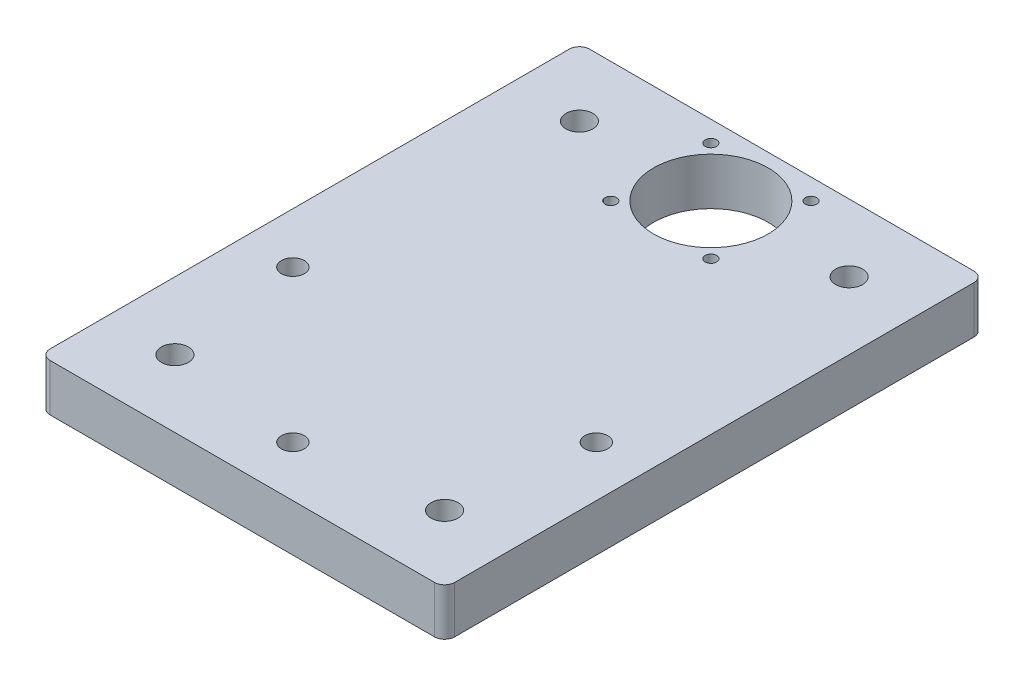
from build123d import *

# Parameters (mm, degrees)
EXTRUDE_1_DEPTH     = 14
SKETCH_3_R          = 1.7
CUT_EXTRUDE_1_DEPTH = 118.45637488
SKETCH_4_R          = 3.4
CUT_EXTRUDE_2_DEPTH = 118.45637488
SKETCH_5_R          = 16.999999997
CUT_EXTRUDE_3_DEPTH = 118.45637488
SKETCH_6_R          = 4
CUT_EXTRUDE_4_DEPTH = 118.45637488


with BuildPart() as part:
    # 草图1 → 凸台-拉伸1 (new body)
    with BuildSketch(Plane(origin=(0, 0, 0), x_dir=(1, 0, 0), z_dir=(0, 1, 0))):
        with BuildLine():
            Line((-57, -100), (57, -100))
            ThreePointArc((57, -100), (59.121320344, -99.121320344), (60, -97))
            Line((60, -97), (60, 57))
            ThreePointArc((60, 57), (59.121320344, 59.121320344), (57, 60))
            Line((57, 60), (-57, 60))
            ThreePointArc((-57, 60), (-59.121320344, 59.121320344), (-60, 57))
            Line((-60, 57), (-60, -97))
            ThreePointArc((-60, -97), (-59.121320344, -99.121320344), (-57, -100))
        make_face()
    extrude(amount=EXTRUDE_1_DEPTH)

    # 草图3 → 切除-拉伸1 (cut, through all)
    with BuildSketch(Plane.XZ):
        with Locations((14.849242405, -24.150757595)):
            Circle(SKETCH_3_R)
        with Locations((14.849242405, -53.849242405)):
            Circle(SKETCH_3_R)
        with Locations((-14.849242405, -53.849242405)):
            Circle(SKETCH_3_R)
        with Locations((-14.849242405, -24.150757595)):
            Circle(SKETCH_3_R)
    extrude(amount=-CUT_EXTRUDE_1_DEPTH, mode=Mode.SUBTRACT)

    # 草图4 → 切除-拉伸2 (cut, through all)
    with BuildSketch(Plane.XZ):
        with Locations((0, 85)):
            Circle(SKETCH_4_R)
        with Locations((45, 40)):
            Circle(SKETCH_4_R)
        with Locations((-45, 40)):
            Circle(SKETCH_4_R)
    extrude(amount=-CUT_EXTRUDE_2_DEPTH, mode=Mode.SUBTRACT)

    # 草图5 → 切除-拉伸3 (cut, through all)
    with BuildSketch(Plane(origin=(0, 14, 0), x_dir=(1, 0, 0), z_dir=(0, 1, 0))):
        with Locations((4e-09, 38.999999996)):
            Circle(SKETCH_5_R)
    extrude(amount=-CUT_EXTRUDE_3_DEPTH, mode=Mode.SUBTRACT)

    # 草图6 → 切除-拉伸4 (cut, through all)
    with BuildSketch(Plane.XZ):
        with Locations((40, 80)):
            Circle(SKETCH_6_R)
        with Locations((-40, 80)):
            Circle(SKETCH_6_R)
        with Locations((40, -40)):
            Circle(SKETCH_6_R)
        with Locations((-40, -40)):
            Circle(SKETCH_6_R)
    extrude(amount=-CUT_EXTRUDE_4_DEPTH, mode=Mode.SUBTRACT)


solid = part.part
